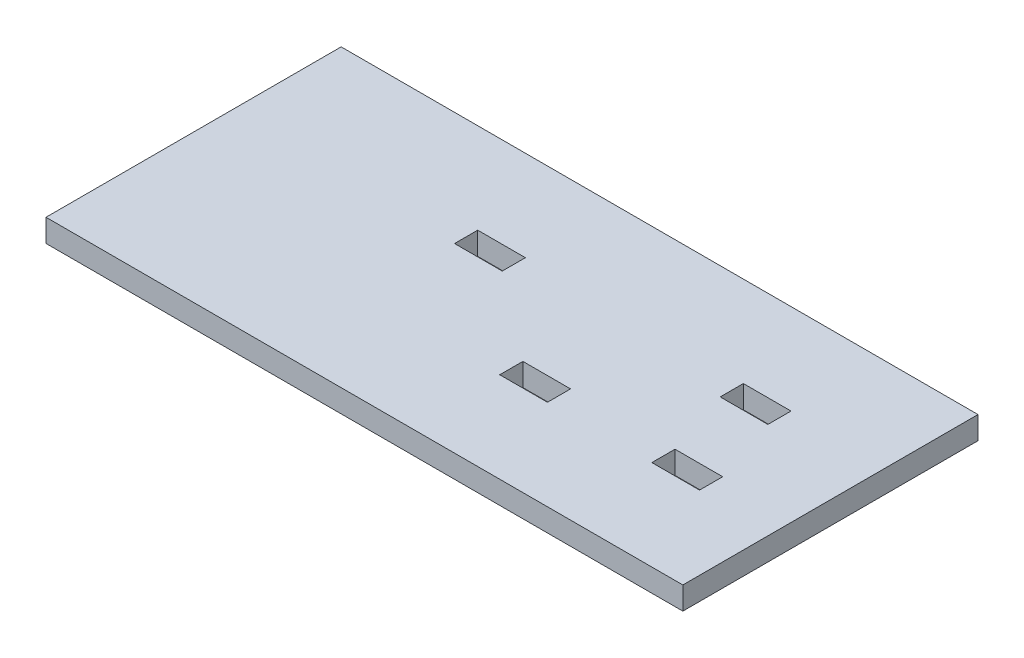
from build123d import *

# Parameters (mm, degrees)
SKETCH1_W          = 140.25
SKETCH1_H          = 65
SKETCH1_W_2        = 10.5
SKETCH1_H_2        = 5.1
BASE_FLANGE1_DEPTH = 5


# Sheet-metal steps are written as plain solids
with BuildPart() as part:
    # Sketch1 → Base-Flange1 (new body)
    with BuildSketch(Plane(origin=(0, 0, 0), x_dir=(1, 0, 0), z_dir=(0, 1, 0))):
        Rectangle(SKETCH1_W, SKETCH1_H)
        with Locations((-14.875, 10.025)):
            Rectangle(SKETCH1_W_2, SKETCH1_H_2, mode=Mode.SUBTRACT)
        with Locations((43.625, 10.025)):
            Rectangle(SKETCH1_W_2, SKETCH1_H_2, mode=Mode.SUBTRACT)
        with Locations((15.125, -10.025)):
            Rectangle(SKETCH1_W_2, SKETCH1_H_2, mode=Mode.SUBTRACT)
        with Locations((48.625, -10.025)):
            Rectangle(SKETCH1_W_2, SKETCH1_H_2, mode=Mode.SUBTRACT)
    extrude(amount=-BASE_FLANGE1_DEPTH)


solid = part.part
